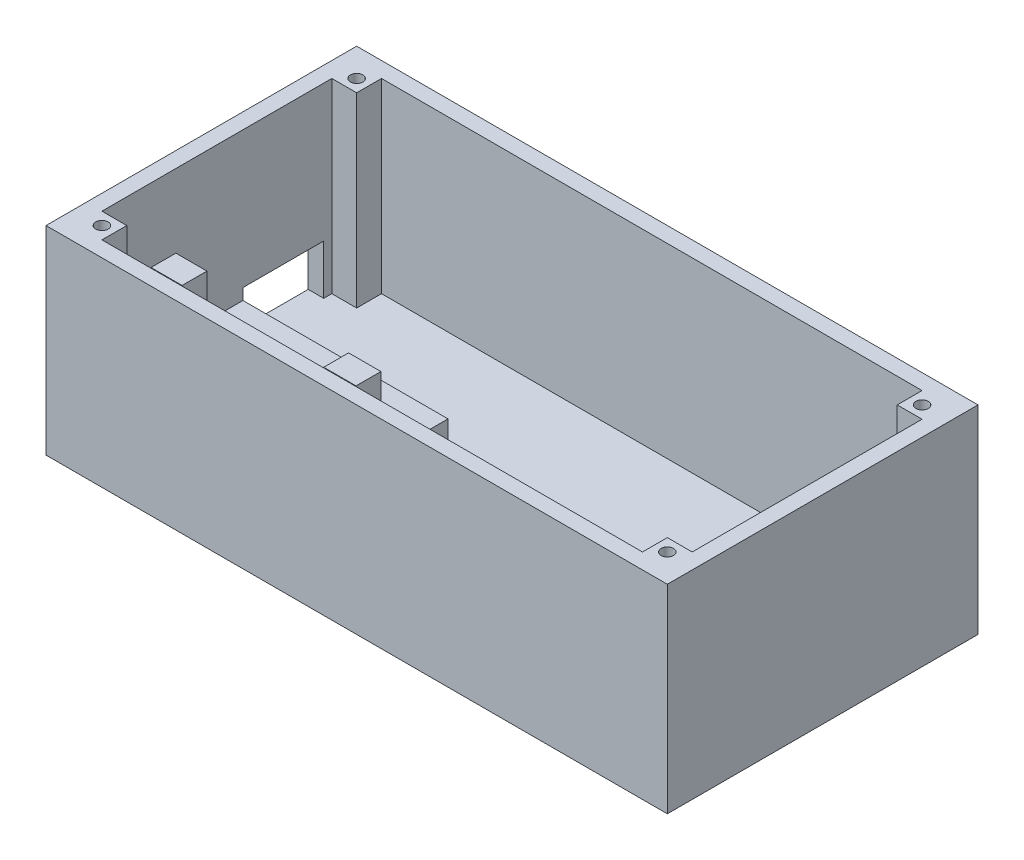
from build123d import *

# Parameters (mm, degrees)
SKETCH1_W           = 100
SKETCH1_H           = 50
BOSS_EXTRUDE1_DEPTH = 2
SKETCH3_W           = 100
SKETCH3_H           = 50
SKETCH3_R           = 1
BOSS_EXTRUDE2_DEPTH = 30
BOSS_EXTRUDE3_DEPTH = 6.2
SKETCH6_W           = 5
SKETCH6_H           = 4
SKETCH6_W_2         = 5.2
BOSS_EXTRUDE4_DEPTH = 12
SKETCH7_W           = 13
SKETCH7_H           = 8
CUT_EXTRUDE1_DEPTH  = 15


with BuildPart() as part:
    # Sketch1 → Boss-Extrude1 (new body)
    with BuildSketch(Plane(origin=(0, 0, 0), x_dir=(1, 0, 0), z_dir=(0, 1, 0))):
        with Locations((50, 25)):
            Rectangle(SKETCH1_W, SKETCH1_H)
    extrude(amount=BOSS_EXTRUDE1_DEPTH)

    # Sketch3 → Boss-Extrude2 (add)
    with BuildSketch(Plane(origin=(0, 2, 0), x_dir=(1, 0, 0), z_dir=(0, 1, 0))):
        with Locations((50, 25)):
            Rectangle(SKETCH3_W, SKETCH3_H)
        with Locations((4.5, 45.5)):
            Circle(SKETCH3_R, mode=Mode.SUBTRACT)
        with Locations((95.5, 45.5)):
            Circle(SKETCH3_R, mode=Mode.SUBTRACT)
        with Locations((95.5, 4.5)):
            Circle(SKETCH3_R, mode=Mode.SUBTRACT)
        with Locations((4.5, 4.5)):
            Circle(SKETCH3_R, mode=Mode.SUBTRACT)
        Polygon((6.5, 47.5), (93.5, 47.5), (93.5, 43.5), (97.5, 43.5), (97.5, 6.5), (93.5, 6.5), (93.5, 2.5), (6.5, 2.5), (6.5, 6.5), (2.5, 6.5), (2.5, 43.5), (6.5, 43.5), align=None, mode=Mode.SUBTRACT)
    extrude(amount=BOSS_EXTRUDE2_DEPTH)

    # Sketch4 → Boss-Extrude3 (add)
    with BuildSketch(Plane(origin=(0, 2, 0), x_dir=(1, 0, 0), z_dir=(0, 1, 0))):
        Polygon((2.5, 29.2), (35.5, 29.2), (35.5, 2.5), (6.5, 2.5), (6.5, 6.5), (2.5, 6.5), align=None)
    extrude(amount=BOSS_EXTRUDE3_DEPTH)

    # Sketch6 → Boss-Extrude4 (add)
    with BuildSketch(Plane(origin=(0, 8.2, 0), x_dir=(1, 0, 0), z_dir=(0, 1, 0))):
        with Locations((5, 16.4)):
            Rectangle(SKETCH6_W, SKETCH6_H)
        with Locations((32.9, 16.4)):
            Rectangle(SKETCH6_W_2, SKETCH6_H)
    extrude(amount=BOSS_EXTRUDE4_DEPTH)

    # Sketch7 → Cut-Extrude1 (cut)
    with BuildSketch(Plane(origin=(2.5, 0, 0), x_dir=(0, 0, -1), z_dir=(1, 0, 0))):
        with Locations((35.7, 6)):
            Rectangle(SKETCH7_W, SKETCH7_H)
    extrude(amount=-CUT_EXTRUDE1_DEPTH, mode=Mode.SUBTRACT)


solid = part.part
